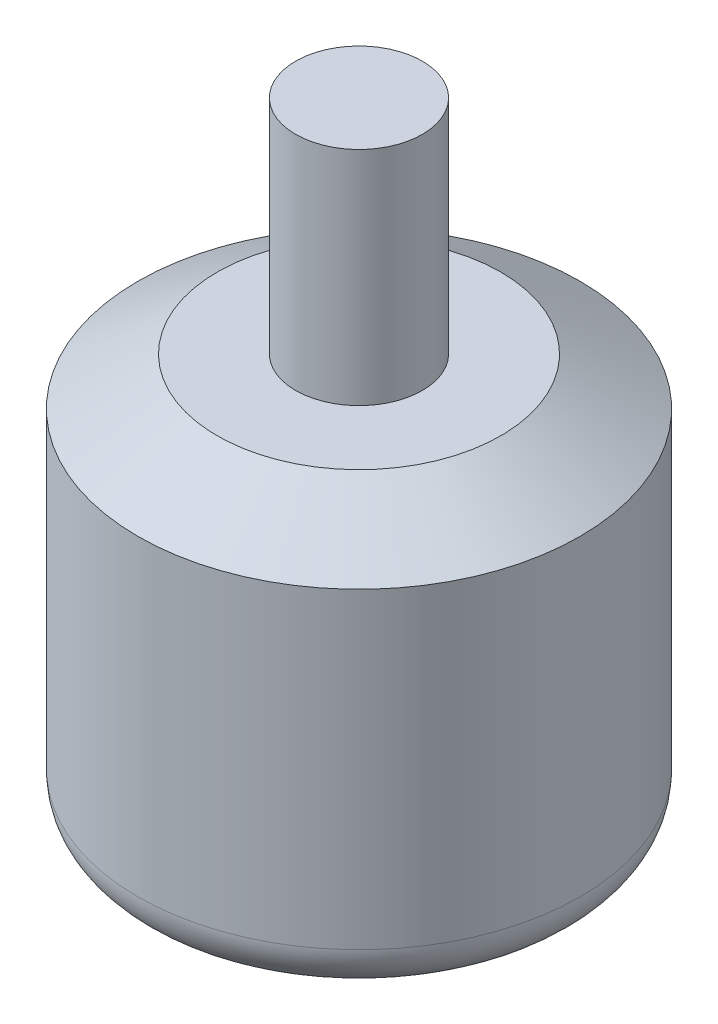
from build123d import *

# Parameters (mm, degrees)
SKETCH1_R                 = 13.95
BOSS_EXTRUDE1_DEPTH       = 25.7
CHAMFER1_SIZE             = 3
CHAMFER1_SIZE2            = 5
SKETCH2_R                 = 4
BOSS_EXTRUDE2_DEPTH       = 14
M3X0_5_TAPPED_HOLE1_D     = 2.5
M3X0_5_TAPPED_HOLE1_DEPTH = 7.5
M3X0_5_TAPPED_HOLE1_TIP   = 0.751075774
FILLET1_R                 = 3
SKETCH5_R                 = 3
BOSS_EXTRUDE3_DEPTH       = 2.5


with BuildPart() as part:
    # Sketch1 → Boss-Extrude1 (new body)
    with BuildSketch(Plane(origin=(0, 0, 0), x_dir=(1, 0, 0), z_dir=(0, 1, 0))):
        Circle(SKETCH1_R)
    extrude(amount=BOSS_EXTRUDE1_DEPTH)

    # Chamfer1
    chamfer1_edges = [part.edges().sort_by_distance(p)[0] for p in [
        (-13.95, 25.7, 0),
    ]]
    chamfer1_side = [part.faces().sort_by_distance(p)[0] for p in [
        (-13.95, 12.85, 0),
    ]]
    chamfer(chamfer1_edges, length=CHAMFER1_SIZE, length2=CHAMFER1_SIZE2, reference=chamfer1_side[0])

    # Sketch2 → Boss-Extrude2 (add)
    with BuildSketch(Plane(origin=(0, 25.7, 0), x_dir=(1, 0, 0), z_dir=(0, 1, 0))):
        Circle(SKETCH2_R)
    extrude(amount=BOSS_EXTRUDE2_DEPTH)

    # M3x0.5 Tapped Hole1
    with Locations(Plane(origin=(0, 0, 0), x_dir=(-1, 0, 0), z_dir=(0, -1, 0))):
        with Locations((0, 8), (0, -8), (-9.5, 0), (9.5, 0)):
            Hole(M3X0_5_TAPPED_HOLE1_D / 2, depth=M3X0_5_TAPPED_HOLE1_DEPTH)
            with Locations((0, 0, -(M3X0_5_TAPPED_HOLE1_DEPTH + M3X0_5_TAPPED_HOLE1_TIP / 2))):  # 118° drill point
                Cone(0, M3X0_5_TAPPED_HOLE1_D / 2, M3X0_5_TAPPED_HOLE1_TIP, mode=Mode.SUBTRACT)

    # Fillet1
    fillet1_edges = [part.edges().sort_by_distance(p)[0] for p in [
        (-13.95, 0, 0),
    ]]
    fillet(fillet1_edges, radius=FILLET1_R)

    # Sketch5 → Boss-Extrude3 (add)
    with BuildSketch(Plane.XZ):
        Circle(SKETCH5_R)
    extrude(amount=BOSS_EXTRUDE3_DEPTH)


solid = part.part
